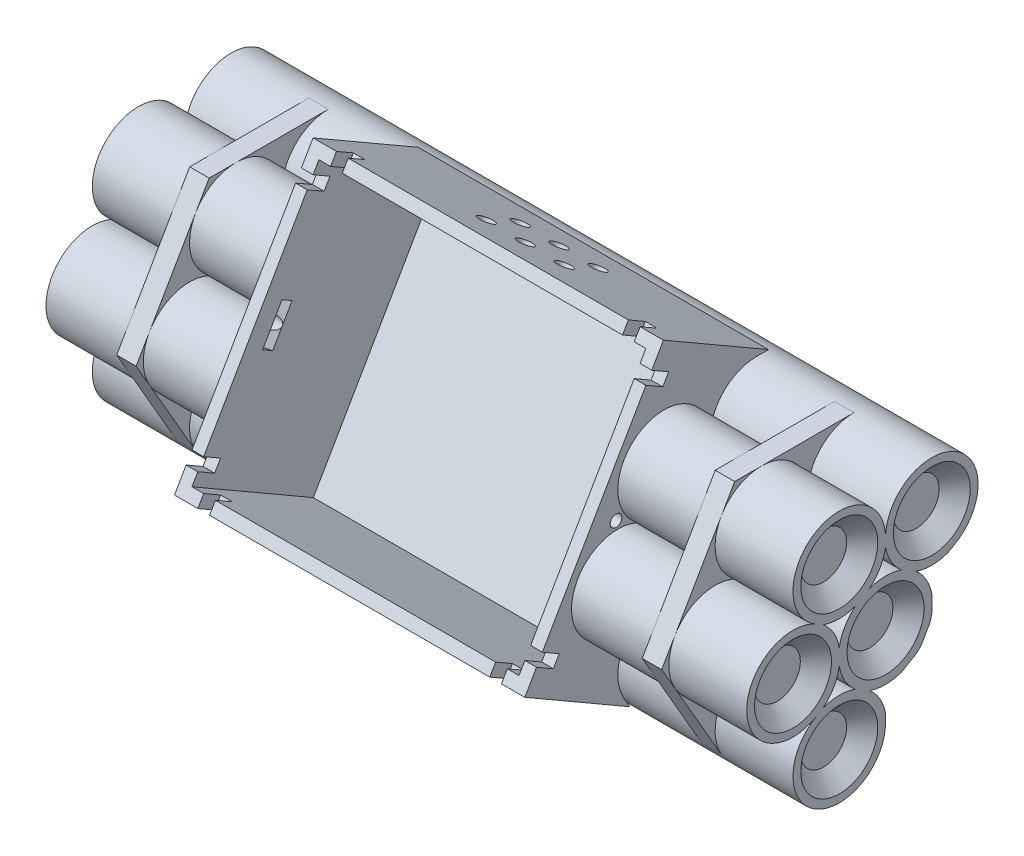
from build123d import *
from build123d.topology import SkipClean

# Parameters (mm, degrees)
BOSS_EXTRUDE1_DEPTH             = 5
BOSS_EXTRUDE7_DEPTH             = 20
BOSS_EXTRUDE7_DEPTH_BACK        = 160
LPATTERN1_COUNT                 = 2
LPATTERN1_PITCH                 = 135
CUT_EXTRUDE4_START              = -10
SKETCH7_R                       = 10
CUT_EXTRUDE4_DEPTH              = 160
CUT_EXTRUDE5_DEPTH              = 187.710839268
BOSS_EXTRUDE9_START             = -110
BOSS_EXTRUDE9_DEPTH             = 90
FILLET6_R                       = 1
SKETCH14_W                      = 84
SKETCH14_H                      = 65.2
CUT_EXTRUDE6_DEPTH              = 2
SKETCH15_W                      = 10.666666666
SKETCH15_H                      = 4
SKETCH15_W_2                    = 74
SKETCH15_H_2                    = 10
SKETCH15_W_3                    = 10.666666667
BOSS_EXTRUDE10_DEPTH            = 2
CUT_EXTRUDE8_DEPTH              = 177.671640726
CUT_EXTRUDE9_START              = -10
SKETCH21_R                      = 9.887023679
CUT_EXTRUDE9_DEPTH              = 4
BOSS_EXTRUDE11_START            = 160
SKETCH26_R                      = 10
BOSS_EXTRUDE11_DEPTH            = 160
CUT_EXTRUDE10_DEPTH             = 192.282170201
CUT_EXTRUDE10_DEPTH_BACK        = 192.282170201
CUT_EXTRUDE11_DEPTH             = 173.156523655
CUT_EXTRUDE11_DEPTH_BACK        = 173.156523655
CHAMFER1_SIZE                   = 4
CUT_EXTRUDE12_DEPTH             = 177.671640726
CUT_EXTRUDE12_DEPTH_BACK        = 177.671640726
CUT_EXTRUDE13_DEPTH             = 155.395170381
BOSS_EXTRUDE14_DEPTH            = 90
SKETCH33_W                      = 84
SKETCH33_H                      = 65.2
CUT_EXTRUDE14_DEPTH             = 36
BOSS_EXTRUDE15_DEPTH            = 3
BOSS_EXTRUDE16_DEPTH            = 3
BOSS_EXTRUDE17_START            = -5
BOSS_EXTRUDE17_DEPTH            = 5
BOSS_EXTRUDE18_DEPTH            = 5
BOSS_EXTRUDE19_START            = -28
BOSS_EXTRUDE19_DEPTH            = 28
BOSS_EXTRUDE20_DEPTH            = 28
CUT_EXTRUDE15_REACH             = 181.77
SKETCH47_R                      = 2
SKETCH48_W                      = 3
SKETCH48_H                      = 3
CUT_EXTRUDE16_DEPTH             = 5
CUT_EXTRUDE17_DEPTH             = 5
CUT_EXTRUDE17_DEPTH_BACK        = 5
CUT_EXTRUDE18_REACH             = 150.343
SKETCH52_R                      = 1.5
CUT_EXTRUDE18_DIRECTION_2_REACH = 150.343


# Read off the part's stored shape, not the designer's step: Boss-Extrude9
with BuildPart() as part:
    # Sketch3 → Boss-Extrude1 (new body)
    with BuildSketch(Plane(origin=(0, 0, 0), x_dir=(0, 0, -1), z_dir=(1, 0, 0))):
        Polygon((18.75, 32.475952642), (-18.75, 32.475952642), (-37.5, 0), (-18.75, -32.475952642), (18.75, -32.475952642), (37.5, 0), align=None)
    boss_extrude1 = extrude(amount=BOSS_EXTRUDE1_DEPTH)

    # Sketch4 → Boss-Extrude7 (add, two sides: drawn at the far end of the back side and taken through both)
    with BuildSketch(Plane(origin=(5, 0, 0), x_dir=(0, 0, -1), z_dir=(1, 0, 0)).offset(-BOSS_EXTRUDE7_DEPTH_BACK)):
        with BuildLine():
            ThreePointArc((0, 20.588928963), (-17.830535519, 30.883393444), (-17.830535519, 10.294464481))
            ThreePointArc((-17.830535519, 10.294464481), (-35.661071037, 0), (-17.830535519, -10.294464481))
            ThreePointArc((-17.830535519, -10.294464481), (-17.830535519, -30.883393444), (0, -20.588928963))
            ThreePointArc((0, -20.588928963), (17.830535519, -30.883393444), (17.830535519, -10.294464481))
            ThreePointArc((17.830535519, -10.294464481), (35.661071037, 0), (17.830535519, 10.294464481))
            ThreePointArc((17.830535519, 10.294464481), (17.830535519, 30.883393444), (0, 20.588928963))
        make_face()
    extrude(amount=BOSS_EXTRUDE7_DEPTH + BOSS_EXTRUDE7_DEPTH_BACK)

    # LPattern1: Boss-Extrude1 ×2
    with Locations(*[(-i * LPATTERN1_PITCH, 0, 0) for i in range(1, LPATTERN1_COUNT)]):
        add(boss_extrude1)

    # Sketch7 → Cut-Extrude4 (cut)
    with BuildSketch(Plane(origin=(25, 0, 0), x_dir=(0, 0, -1), z_dir=(1, 0, 0)).offset(CUT_EXTRUDE4_START)):
        with Locations((-11.887023679, 20.588928963)):
            Circle(SKETCH7_R)
        with Locations((11.887023679, 20.588928963)):
            Circle(SKETCH7_R)
        Circle(SKETCH7_R)
        with Locations((23.774047358, 0)):
            Circle(SKETCH7_R)
        with Locations((11.887023679, -20.588928963)):
            Circle(SKETCH7_R)
        with Locations((-11.887023679, -20.588928963)):
            Circle(SKETCH7_R)
        with Locations((-23.774047358, 0)):
            Circle(SKETCH7_R)
    extrude(amount=-CUT_EXTRUDE4_DEPTH, mode=Mode.SUBTRACT)

    # Sketch10 → Cut-Extrude5 (cut, through all)
    with BuildSketch(Plane(origin=(25, 0, 0), x_dir=(0, 0, -1), z_dir=(1, 0, 0))):
        with BuildLine():
            ThreePointArc((-15.978981211, 9.225469104), (-11.887023679, 8.511166901), (-7.795066147, 9.225469104))
            ThreePointArc((-7.795066147, 9.225469104), (-10.459648766, 6.038881031), (-11.887023679, 2.137990756))
            ThreePointArc((-11.887023679, 2.137990756), (-13.314398592, 6.038881031), (-15.978981211, 9.225469104))
        make_face()
        with BuildLine():
            ThreePointArc((0, 18.450938207), (1.427374913, 14.550047932), (4.091957532, 11.363459859))
            ThreePointArc((4.091957532, 11.363459859), (0, 12.077762062), (-4.091957532, 11.363459859))
            ThreePointArc((-4.091957532, 11.363459859), (-1.427374913, 14.550047932), (0, 18.450938207))
        make_face()
        with BuildLine():
            ThreePointArc((15.978981211, 9.225469104), (13.314398592, 6.038881031), (11.887023679, 2.137990756))
            ThreePointArc((11.887023679, 2.137990756), (10.459648766, 6.038881031), (7.795066147, 9.225469104))
            ThreePointArc((7.795066147, 9.225469104), (11.887023679, 8.511166901), (15.978981211, 9.225469104))
        make_face()
        with BuildLine():
            ThreePointArc((15.978981211, -9.225469104), (11.887023679, -8.511166901), (7.795066147, -9.225469104))
            ThreePointArc((7.795066147, -9.225469104), (10.459648766, -6.038881031), (11.887023679, -2.137990756))
            ThreePointArc((11.887023679, -2.137990756), (13.314398592, -6.038881031), (15.978981211, -9.225469104))
        make_face()
        with BuildLine():
            ThreePointArc((0, -18.450938207), (-1.427374913, -14.550047932), (-4.091957532, -11.363459859))
            ThreePointArc((-4.091957532, -11.363459859), (0, -12.077762062), (4.091957532, -11.363459859))
            ThreePointArc((4.091957532, -11.363459859), (1.427374913, -14.550047932), (0, -18.450938207))
        make_face()
        with BuildLine():
            ThreePointArc((-15.978981211, -9.225469104), (-13.314398592, -6.038881031), (-11.887023679, -2.137990756))
            ThreePointArc((-11.887023679, -2.137990756), (-10.459648766, -6.038881031), (-7.795066147, -9.225469104))
            ThreePointArc((-7.795066147, -9.225469104), (-11.887023679, -8.511166901), (-15.978981211, -9.225469104))
        make_face()
    extrude(amount=-CUT_EXTRUDE5_DEPTH, mode=Mode.SUBTRACT)

    # Boss-Extrude9 outline → Boss-Extrude9 (add)
    with BuildSketch(Plane.YZ.offset(BOSS_EXTRUDE9_START)):
        with BuildLine():
            Line((-9.592528054, 54.585254038), (-30.228803441, 18.842176589))
            ThreePointArc((-30.228803441, 18.842176589), (-19.986453709, 23.758769782), (-10.294464481, 17.830535519))
            ThreePointArc((-10.294464481, 17.830535519), (0, 35.661071037), (10.294464481, 17.830535519))
            ThreePointArc((10.294464481, 17.830535519), (30.883393444, 17.830535519), (20.588928963, 0))
            ThreePointArc((20.588928963, 0), (30.568925047, -5.429391752), (31.432205309, -16.75782341))
            Line((31.432205309, -16.75782341), (52.068480696, 18.985254038))
            Line((52.068480696, 18.985254038), (-9.592528054, 54.585254038))
        make_face()
    extrude(amount=BOSS_EXTRUDE9_DEPTH)

    # Fillet6
    fillet6_edges = [part.edges().sort_by_distance(p)[0] for p in [
        (-110, 21.237976321, 36.785254038),
        (-65, -9.592528054, 54.585254038),
        (-20, 21.237976321, 36.785254038),
        (-65, 52.068480696, 18.985254038),
    ]]
    fillet(fillet6_edges, radius=FILLET6_R)

    # Sketch14 → Cut-Extrude6 (cut)
    with BuildSketch(Plane(origin=(0, 21.237976321, 36.785254038), x_dir=(1, 0, 0), z_dir=(0, 0.49999999999999967, 0.8660254037844389))):
        with Locations((-65, 0)):
            Rectangle(SKETCH14_W, SKETCH14_H)
    extrude(amount=-CUT_EXTRUDE6_DEPTH, mode=Mode.SUBTRACT)

    # Sketch15 → Boss-Extrude10 (add)
    with BuildSketch(Plane(origin=(0, 20.237976321, 35.05320323), x_dir=(1, 0, 0), z_dir=(0, 0.4999999999999996, 0.8660254037844389))):
        with Locations((-84, 15.6)):
            Rectangle(SKETCH15_W, SKETCH15_H)
        with Locations((-65, 24.6)):
            Rectangle(SKETCH15_W_2, SKETCH15_H_2)
        with Locations((-96.666666666, 15.6)):
            Rectangle(SKETCH15_W_3, SKETCH15_H)
        with Locations((-71.333333334, 15.6)):
            Rectangle(SKETCH15_W_3, SKETCH15_H)
        with Locations((-58.666666667, 15.6)):
            Rectangle(SKETCH15_W_3, SKETCH15_H)
        with Locations((-46, 15.6)):
            Rectangle(SKETCH15_W, SKETCH15_H)
        with Locations((-33.333333334, 15.6)):
            Rectangle(SKETCH15_W_3, SKETCH15_H)
        with Locations((-84, 9.6)):
            Rectangle(SKETCH15_W, SKETCH15_H)
        with Locations((-71.333333334, 9.6)):
            Rectangle(SKETCH15_W_3, SKETCH15_H)
        with Locations((-58.666666667, 9.6)):
            Rectangle(SKETCH15_W_3, SKETCH15_H)
        with Locations((-46, 9.6)):
            Rectangle(SKETCH15_W, SKETCH15_H)
        with Locations((-33.333333334, 9.6)):
            Rectangle(SKETCH15_W_3, SKETCH15_H)
        with Locations((-84, 3.6)):
            Rectangle(SKETCH15_W, SKETCH15_H)
        with Locations((-71.333333334, 3.6)):
            Rectangle(SKETCH15_W_3, SKETCH15_H)
        with Locations((-58.666666667, 3.6)):
            Rectangle(SKETCH15_W_3, SKETCH15_H)
        with Locations((-46, 3.6)):
            Rectangle(SKETCH15_W, SKETCH15_H)
        with Locations((-33.333333334, 3.6)):
            Rectangle(SKETCH15_W_3, SKETCH15_H)
        with Locations((-96.666666666, 9.6)):
            Rectangle(SKETCH15_W_3, SKETCH15_H)
        with Locations((-96.666666666, 3.6)):
            Rectangle(SKETCH15_W_3, SKETCH15_H)
    extrude(amount=BOSS_EXTRUDE10_DEPTH)

    # loft from a face of the part (loft1)
    loft([part.faces().sort_by_distance((-38.666666667, 23.855667775, 34.119228634))[0], part.faces().sort_by_distance((-40.666666667, 23.855667775, 34.119228634))[0]])

    # loft from a face of the part (loft2)
    loft([part.faces().sort_by_distance((-38.666666667, 29.051820197, 31.119228634))[0], part.faces().sort_by_distance((-40.666666667, 29.051820197, 31.119228634))[0]])

    # loft from a face of the part (loft3)
    loft([part.faces().sort_by_distance((-40.666666667, 34.24797262, 28.119228634))[0], part.faces().sort_by_distance((-38.666666667, 34.24797262, 28.119228634))[0]])

    # Sketch17 → Cut-Extrude8 (cut, through all)
    with BuildSketch(Plane(origin=(5, 0, 0), x_dir=(0, 0, -1), z_dir=(1, 0, 0))):
        with BuildLine():
            Line((3.441779924, 30.975952642), (-3.441779924, 30.975952642))
            ThreePointArc((-3.441779924, 30.975952642), (-1.503231797, 29.038146035), (0, 26.746125649))
            ThreePointArc((0, 26.746125649), (1.503231797, 29.038146035), (3.441779924, 30.975952642))
        make_face()
        with BuildLine():
            Line((-25.105071932, 18.46864517), (-28.546851857, 12.507307472))
            ThreePointArc((-28.546851857, 12.507307472), (-25.899388044, 13.217236094), (-23.162824265, 13.373062825))
            ThreePointArc((-23.162824265, 13.373062825), (-24.396156247, 15.820909942), (-25.105071932, 18.46864517))
        make_face()
        with BuildLine():
            Line((28.546851857, 12.507307472), (25.105071932, 18.46864517))
            ThreePointArc((25.105071932, 18.46864517), (24.396156247, 15.820909942), (23.162824265, 13.373062825))
            ThreePointArc((23.162824265, 13.373062825), (25.899388044, 13.217236094), (28.546851857, 12.507307472))
        make_face()
        with BuildLine():
            Line((25.105071932, -18.46864517), (28.546851857, -12.507307472))
            ThreePointArc((28.546851857, -12.507307472), (25.899388044, -13.217236094), (23.162824265, -13.373062825))
            ThreePointArc((23.162824265, -13.373062825), (24.396156247, -15.820909942), (25.105071932, -18.46864517))
        make_face()
        with BuildLine():
            Line((-3.441779924, -30.975952642), (3.441779924, -30.975952642))
            ThreePointArc((3.441779924, -30.975952642), (1.503231797, -29.038146035), (0, -26.746125649))
            ThreePointArc((0, -26.746125649), (-1.503231797, -29.038146035), (-3.441779924, -30.975952642))
        make_face()
        with BuildLine():
            Line((-28.546851857, -12.507307472), (-25.105071932, -18.46864517))
            ThreePointArc((-25.105071932, -18.46864517), (-24.396156247, -15.820909942), (-23.162824265, -13.373062825))
            ThreePointArc((-23.162824265, -13.373062825), (-25.899388044, -13.217236094), (-28.546851857, -12.507307472))
        make_face()
    extrude(amount=-CUT_EXTRUDE8_DEPTH, mode=Mode.SUBTRACT)

    # Sketch21 → Cut-Extrude9 (cut)
    with BuildSketch(Plane(origin=(-145, 0, 0), x_dir=(0, 0, -1), z_dir=(1, 0, 0)).offset(CUT_EXTRUDE9_START)):
        with Locations((11.887023679, 20.588928963)):
            Circle(SKETCH21_R)
        with Locations((-11.887023679, 20.588928963)):
            Circle(SKETCH21_R)
        with Locations((23.774047358, 0)):
            Circle(SKETCH21_R)
        with Locations((11.887023679, -20.588928963)):
            Circle(SKETCH21_R)
        with Locations((-11.887023679, -20.588928963)):
            Circle(SKETCH21_R)
        with Locations((-23.774047358, 0)):
            Circle(SKETCH21_R)
        Circle(SKETCH21_R)
    cut_extrude9 = extrude(amount=CUT_EXTRUDE9_DEPTH, mode=Mode.SUBTRACT)

    # Mirror1: Cut-Extrude9 across plane
    add(cut_extrude9.mirror(Plane(origin=(-65, 0, 0), x_dir=(0, 0, 1), z_dir=(1, 0, 0))), mode=Mode.SUBTRACT)

    # Sketch26 → Boss-Extrude11 (add)
    with BuildSketch(Plane(origin=(-145, 0, 0), x_dir=(0, 0, -1), z_dir=(1, 0, 0)).offset(BOSS_EXTRUDE11_START)):
        with Locations((11.887023679, -20.588928963)):
            Circle(SKETCH26_R)
        with Locations((-11.887023679, -20.588928963)):
            Circle(SKETCH26_R)
        with Locations((-23.774047358, 0)):
            Circle(SKETCH26_R)
        with Locations((-11.887023679, 20.588928963)):
            Circle(SKETCH26_R)
        with Locations((11.887023679, 20.588928963)):
            Circle(SKETCH26_R)
        Circle(SKETCH26_R)
        with Locations((23.774047358, 0)):
            Circle(SKETCH26_R)
    extrude(amount=-BOSS_EXTRUDE11_DEPTH)

    # Sketch27 → Cut-Extrude10 (cut, two sides: drawn at the far end of the back side and taken through both)
    with SkipClean():  # the faces are left unmerged after this step: merging them gives an invalid solid
        with BuildSketch(Plane(origin=(21, 0, 0), x_dir=(0, 0, -1), z_dir=(1, 0, 0)).offset(-CUT_EXTRUDE10_DEPTH_BACK)):
            with BuildLine():
                Line((17.830535519, 10.294464481), (15.978981211, 9.225469104))
                ThreePointArc((15.978981211, 9.225469104), (13.314398592, 6.038881031), (11.887023679, 2.137990756))
                Line((11.887023679, 2.137990756), (11.887023679, -2.137990756))
                ThreePointArc((11.887023679, -2.137990756), (10.459648766, -6.038881031), (7.795066147, -9.225469104))
                Line((7.795066147, -9.225469104), (4.091957532, -11.363459859))
                ThreePointArc((4.091957532, -11.363459859), (1.427374913, -14.550047932), (0, -18.450938207))
                Line((0, -18.450938207), (0, -20.588928963))
                ThreePointArc((0, -20.588928963), (-3.481628627, -28.994324014), (-11.887023679, -32.475952642))
                Line((-11.887023679, -32.475952642), (11.887023679, -32.475952642))
                Line((11.887023679, -32.475952642), (18.75, -32.475952642))
                Line((18.75, -32.475952642), (22.18148816, -26.532440802))
                Line((22.18148816, -26.532440802), (34.06851184, -5.94351184))
                Line((34.06851184, -5.94351184), (37.5, 0))
                Line((37.5, 0), (34.06851184, 5.94351184))
                Line((34.06851184, 5.94351184), (22.18148816, 26.532440802))
                ThreePointArc((22.18148816, 26.532440802), (23.369006848, 17.512340845), (17.830535519, 10.294464481))
            make_face()
        extrude(amount=CUT_EXTRUDE10_DEPTH + CUT_EXTRUDE10_DEPTH_BACK, mode=Mode.SUBTRACT)
    add(part.part.scale(1), mode=Mode.REPLACE)  # the faces are merged on a copy

    # Sketch28 → Cut-Extrude11 (cut, two sides: drawn at the far end of the back side and taken through both)
    with BuildSketch(Plane(origin=(0, 0, 0), x_dir=(0, 0, -1), z_dir=(1, 0, 0)).offset(-CUT_EXTRUDE11_DEPTH_BACK)):
        Polygon((22.18148816, 14.645417123), (-1.592559198, -26.532440802), (30.883393444, -17.830535519), align=None)
    extrude(amount=CUT_EXTRUDE11_DEPTH + CUT_EXTRUDE11_DEPTH_BACK, mode=Mode.SUBTRACT)

    # Chamfer1
    chamfer1_edges = [part.edges().sort_by_distance(p)[0] for p in [
        (-151, 20.588928963, 21.774047358),
        (-151, 20.588928963, -2),
        (-151, 0, 9.887023679),
        (-151, -20.588928963, 21.774047358),
        (-151, 0, 33.661071037),
        (21, 20.588928963, 21.774047358),
        (21, 20.588928963, -2),
        (21, 0, 9.887023679),
        (21, -20.588928963, 21.774047358),
        (21, 0, 33.661071037),
    ]]
    chamfer(chamfer1_edges, length=CHAMFER1_SIZE - 0.0001)  # a hair under: the kernel refuses the full size

    # Sketch29 → Cut-Extrude12 (cut, two sides: drawn at the far end of the back side and taken through both)
    with BuildSketch(Plane(origin=(5, 0, 0), x_dir=(0, 0, -1), z_dir=(1, 0, 0)).offset(-CUT_EXTRUDE12_DEPTH_BACK)):
        with BuildLine():
            Line((-22.18148816, -26.532440802), (-18.75, -32.475952642))
            Line((-18.75, -32.475952642), (-11.887023679, -32.475952642))
            ThreePointArc((-11.887023679, -32.475952642), (-17.830535519, -30.883393444), (-22.18148816, -26.532440802))
        make_face()
        with BuildLine():
            Line((22.18148816, 26.532440802), (18.75, 32.475952642))
            Line((18.75, 32.475952642), (11.887023679, 32.475952642))
            ThreePointArc((11.887023679, 32.475952642), (17.830535519, 30.883393444), (22.18148816, 26.532440802))
        make_face()
    extrude(amount=CUT_EXTRUDE12_DEPTH + CUT_EXTRUDE12_DEPTH_BACK, mode=Mode.SUBTRACT)

    # Sketch31 → Cut-Extrude13 (cut, through all)
    with BuildSketch(Plane.ZY.offset(110)):
        Polygon((47.657050808, -13.592528054), (12.057050808, 48.068480696), (18.985254038, 52.068480696), (54.585254038, -9.592528054), align=None)
    extrude(amount=-CUT_EXTRUDE13_DEPTH, mode=Mode.SUBTRACT)

    # Sketch32 → Boss-Extrude14 (add)
    with BuildSketch(Plane(origin=(-20, 0, 0), x_dir=(0, 0, -1), z_dir=(1, 0, 0))):
        with BuildLine():
            Line((-28.546851857, 12.507307472), (-25.105071932, 18.46864517))
            ThreePointArc((-25.105071932, 18.46864517), (-24.396156247, 15.820909942), (-23.162824265, 13.373062825))
            ThreePointArc((-23.162824265, 13.373062825), (-25.899388044, 13.217236094), (-28.546851857, 12.507307472))
        make_face()
    extrude(amount=-BOSS_EXTRUDE14_DEPTH)

    # Sketch33 → Cut-Extrude14 (cut)
    with BuildSketch(Plane(origin=(0, 17.237976321, 29.857050808), x_dir=(1, 0, 0), z_dir=(0, 0.5000000000000004, 0.8660254037844385))):
        with Locations((-65, 0)):
            Rectangle(SKETCH33_W, SKETCH33_H)
    extrude(amount=-CUT_EXTRUDE14_DEPTH, mode=Mode.SUBTRACT)

    # Sketch39 → Boss-Extrude15 (add)
    with BuildSketch(Plane.ZY.offset(23)):
        Polygon((46.157050808, -10.994451842), (13.557050808, 45.470404484), (-17.619863729, 27.470404484), (14.980136271, -28.994451842), align=None)
    extrude(amount=-BOSS_EXTRUDE15_DEPTH)

    # Sketch40 → Boss-Extrude16 (add)
    with BuildSketch(Plane(origin=(-107, 0, 0), x_dir=(0, 0, -1), z_dir=(1, 0, 0))):
        Polygon((-13.557050808, 45.470404484), (-46.157050808, -10.994451842), (-14.980136271, -28.994451842), (17.619863729, 27.470404484), align=None)
    extrude(amount=-BOSS_EXTRUDE16_DEPTH)

    # Sketch41 → Boss-Extrude17 (add)
    with BuildSketch(Plane.ZY.offset(135).offset(BOSS_EXTRUDE17_START)):
        with BuildLine():
            Line((-3.441779924, 30.975952642), (3.441779924, 30.975952642))
            ThreePointArc((3.441779924, 30.975952642), (1.503231797, 29.038146035), (0, 26.746125649))
            ThreePointArc((0, 26.746125649), (-1.503231797, 29.038146035), (-3.441779924, 30.975952642))
        make_face()
        with BuildLine():
            Line((25.105071932, 18.46864517), (28.546851857, 12.507307472))
            ThreePointArc((28.546851857, 12.507307472), (25.899388044, 13.217236094), (23.162824265, 13.373062825))
            ThreePointArc((23.162824265, 13.373062825), (24.396156247, 15.820909942), (25.105071932, 18.46864517))
        make_face()
        with BuildLine():
            Line((28.546851857, -12.507307472), (25.105071932, -18.46864517))
            ThreePointArc((25.105071932, -18.46864517), (24.396156247, -15.820909942), (23.162824265, -13.373062825))
            ThreePointArc((23.162824265, -13.373062825), (25.899388044, -13.217236094), (28.546851857, -12.507307472))
        make_face()
    extrude(amount=BOSS_EXTRUDE17_DEPTH)

    # Sketch42 → Boss-Extrude18 (add)
    with BuildSketch(Plane(origin=(5, 0, 0), x_dir=(0, 0, -1), z_dir=(1, 0, 0))):
        with BuildLine():
            Line((-28.546851857, -12.507307472), (-25.105071932, -18.46864517))
            ThreePointArc((-25.105071932, -18.46864517), (-24.396156247, -15.820909942), (-23.162824265, -13.373062825))
            ThreePointArc((-23.162824265, -13.373062825), (-25.899388044, -13.217236094), (-28.546851857, -12.507307472))
        make_face()
        with BuildLine():
            Line((3.441779924, 30.975952642), (-3.441779924, 30.975952642))
            ThreePointArc((-3.441779924, 30.975952642), (-1.503231797, 29.038146035), (0, 26.746125649))
            ThreePointArc((0, 26.746125649), (1.503231797, 29.038146035), (3.441779924, 30.975952642))
        make_face()
        with BuildLine():
            Line((-25.105071932, 18.46864517), (-28.546851857, 12.507307472))
            ThreePointArc((-28.546851857, 12.507307472), (-25.899388044, 13.217236094), (-23.162824265, 13.373062825))
            ThreePointArc((-23.162824265, 13.373062825), (-24.396156247, 15.820909942), (-25.105071932, 18.46864517))
        make_face()
    extrude(amount=-BOSS_EXTRUDE18_DEPTH)

    # Sketch45 → Boss-Extrude19 (add)
    with BuildSketch(Plane.ZY.offset(135).offset(BOSS_EXTRUDE19_START)):
        with BuildLine():
            ThreePointArc((4.091957532, 11.363459859), (0, 12.077762062), (-4.091957532, 11.363459859))
            ThreePointArc((-4.091957532, 11.363459859), (-1.427374913, 14.550047932), (0, 18.450938207))
            ThreePointArc((0, 18.450938207), (1.427374913, 14.550047932), (4.091957532, 11.363459859))
        make_face()
        with BuildLine():
            ThreePointArc((11.887023679, 2.137990756), (10.459648766, 6.038881031), (7.795066147, 9.225469104))
            ThreePointArc((7.795066147, 9.225469104), (11.887023679, 8.511166901), (15.978981211, 9.225469104))
            ThreePointArc((15.978981211, 9.225469104), (13.314398592, 6.038881031), (11.887023679, 2.137990756))
        make_face()
        with BuildLine():
            ThreePointArc((7.795066147, -9.225469104), (10.459648766, -6.038881031), (11.887023679, -2.137990756))
            ThreePointArc((11.887023679, -2.137990756), (13.314398592, -6.038881031), (15.978981211, -9.225469104))
            ThreePointArc((15.978981211, -9.225469104), (11.887023679, -8.511166901), (7.795066147, -9.225469104))
        make_face()
    extrude(amount=BOSS_EXTRUDE19_DEPTH)

    # Sketch46 → Boss-Extrude20 (add)
    with BuildSketch(Plane(origin=(5, 0, 0), x_dir=(0, 0, -1), z_dir=(1, 0, 0))):
        with BuildLine():
            ThreePointArc((0, 18.450938207), (1.427374913, 14.550047932), (4.091957532, 11.363459859))
            ThreePointArc((4.091957532, 11.363459859), (0, 12.077762062), (-4.091957532, 11.363459859))
            ThreePointArc((-4.091957532, 11.363459859), (-1.427374913, 14.550047932), (0, 18.450938207))
        make_face()
        with BuildLine():
            ThreePointArc((-15.978981211, 9.225469104), (-11.887023679, 8.511166901), (-7.795066147, 9.225469104))
            ThreePointArc((-7.795066147, 9.225469104), (-10.459648766, 6.038881031), (-11.887023679, 2.137990756))
            ThreePointArc((-11.887023679, 2.137990756), (-13.314398592, 6.038881031), (-15.978981211, 9.225469104))
        make_face()
        with BuildLine():
            ThreePointArc((-15.978981211, -9.225469104), (-13.314398592, -6.038881031), (-11.887023679, -2.137990756))
            ThreePointArc((-11.887023679, -2.137990756), (-10.459648766, -6.038881031), (-7.795066147, -9.225469104))
            ThreePointArc((-7.795066147, -9.225469104), (-11.887023679, -8.511166901), (-15.978981211, -9.225469104))
        make_face()
    extrude(amount=-BOSS_EXTRUDE20_DEPTH)

    # Sketch47 → Cut-Extrude15 (cut, up to next)
    with BuildSketch(Plane(origin=(0, 30.830504375, -17.8), x_dir=(1, 0, 0), z_dir=(0, 0.8660254037844389, -0.4999999999999995)), mode=Mode.PRIVATE) as cut_extrude15_sk1:
        with Locations(Location((-75, -23.475952642, 0), (0, 0, 270))):
            Circle(SKETCH47_R)
    cut_extrude15_tool1 = extrude(cut_extrude15_sk1.sketch, amount=-CUT_EXTRUDE15_REACH, mode=Mode.PRIVATE) & part.part
    # Sketch47 → Cut-Extrude15 (cut, up to next)
    with BuildSketch(Plane(origin=(0, 30.830504375, -17.8), x_dir=(1, 0, 0), z_dir=(0, 0.8660254037844389, -0.4999999999999995)), mode=Mode.PRIVATE) as cut_extrude15_sk2:
        with Locations(Location((-65, -23.475952642, 0), (0, 0, 270))):
            Circle(SKETCH47_R)
    cut_extrude15_tool2 = extrude(cut_extrude15_sk2.sketch, amount=-CUT_EXTRUDE15_REACH, mode=Mode.PRIVATE) & part.part
    # Sketch47 → Cut-Extrude15 (cut, up to next)
    with BuildSketch(Plane(origin=(0, 30.830504375, -17.8), x_dir=(1, 0, 0), z_dir=(0, 0.8660254037844389, -0.4999999999999995)), mode=Mode.PRIVATE) as cut_extrude15_sk3:
        with Locations(Location((-55, -23.475952642, 0), (0, 0, 270))):
            Circle(SKETCH47_R)
    cut_extrude15_tool3 = extrude(cut_extrude15_sk3.sketch, amount=-CUT_EXTRUDE15_REACH, mode=Mode.PRIVATE) & part.part
    # Sketch47 → Cut-Extrude15 (cut, up to next)
    with BuildSketch(Plane(origin=(0, 30.830504375, -17.8), x_dir=(1, 0, 0), z_dir=(0, 0.8660254037844389, -0.4999999999999995)), mode=Mode.PRIVATE) as cut_extrude15_sk4:
        with Locations(Location((-65, -13.475952642, 0), (0, 0, 270))):
            Circle(SKETCH47_R)
    cut_extrude15_tool4 = extrude(cut_extrude15_sk4.sketch, amount=-CUT_EXTRUDE15_REACH, mode=Mode.PRIVATE) & part.part
    # Sketch47 → Cut-Extrude15 (cut, up to next)
    with BuildSketch(Plane(origin=(0, 30.830504375, -17.8), x_dir=(1, 0, 0), z_dir=(0, 0.8660254037844389, -0.4999999999999995)), mode=Mode.PRIVATE) as cut_extrude15_sk5:
        with Locations(Location((-55, -13.475952642, 0), (0, 0, 270))):
            Circle(SKETCH47_R)
    cut_extrude15_tool5 = extrude(cut_extrude15_sk5.sketch, amount=-CUT_EXTRUDE15_REACH, mode=Mode.PRIVATE) & part.part
    # Sketch47 → Cut-Extrude15 (cut, up to next)
    with BuildSketch(Plane(origin=(0, 30.830504375, -17.8), x_dir=(1, 0, 0), z_dir=(0, 0.8660254037844389, -0.4999999999999995)), mode=Mode.PRIVATE) as cut_extrude15_sk6:
        with Locations(Location((-75, -13.475952642, 0), (0, 0, 270))):
            Circle(SKETCH47_R)
    cut_extrude15_tool6 = extrude(cut_extrude15_sk6.sketch, amount=-CUT_EXTRUDE15_REACH, mode=Mode.PRIVATE) & part.part
    add(cut_extrude15_tool1.solids().sort_by_distance((-75, 42.568481, 2.530771))[0], mode=Mode.SUBTRACT)
    add(cut_extrude15_tool2.solids().sort_by_distance((-65, 42.568481, 2.530771))[0], mode=Mode.SUBTRACT)
    add(cut_extrude15_tool3.solids().sort_by_distance((-55, 42.568481, 2.530771))[0], mode=Mode.SUBTRACT)
    add(cut_extrude15_tool4.solids().sort_by_distance((-65, 37.568481, -6.129483))[0], mode=Mode.SUBTRACT)
    add(cut_extrude15_tool5.solids().sort_by_distance((-55, 37.568481, -6.129483))[0], mode=Mode.SUBTRACT)
    add(cut_extrude15_tool6.solids().sort_by_distance((-75, 37.568481, -6.129483))[0], mode=Mode.SUBTRACT)

    # Sketch48 → Cut-Extrude16 (cut)
    with BuildSketch(Plane(origin=(0, 17.237976321, 29.857050808), x_dir=(1, 0, 0), z_dir=(0, 0.5000000000000002, 0.8660254037844385))):
        with Locations((-102.5, 34.1)):
            Rectangle(SKETCH48_W, SKETCH48_H)
        with Locations((-102.5, -34.1)):
            Rectangle(SKETCH48_W, SKETCH48_H)
        with Locations((-21.5, -28.1)):
            Rectangle(SKETCH48_W, SKETCH48_H)
        with Locations((-21.5, 28.1)):
            Rectangle(SKETCH48_W, SKETCH48_H)
        with Locations((-108.5, 28.1)):
            Rectangle(SKETCH48_W, SKETCH48_H)
        with Locations((-108.5, -28.1)):
            Rectangle(SKETCH48_W, SKETCH48_H)
        with Locations((-27.5, 34.1)):
            Rectangle(SKETCH48_W, SKETCH48_H)
        with Locations((-27.5, -34.1)):
            Rectangle(SKETCH48_W, SKETCH48_H)
    extrude(amount=-CUT_EXTRUDE16_DEPTH, mode=Mode.SUBTRACT)

    # Sketch50 → Cut-Extrude17 (cut, two sides: drawn at the far end of the back side and taken through both)
    with BuildSketch(Plane(origin=(0, 0, 0), x_dir=(-1, 0, 0), z_dir=(0, -0.8660254037844384, 0.5000000000000006)).offset(-CUT_EXTRUDE17_DEPTH_BACK)):
        Polygon((23, -26.475952642), (21.5, -27.975952642), (23, -29.475952642), align=None)
        Polygon((107, -26.475952642), (108.5, -27.975952642), (107, -29.475952642), align=None)
    extrude(amount=CUT_EXTRUDE17_DEPTH + CUT_EXTRUDE17_DEPTH_BACK, mode=Mode.SUBTRACT)

    # Sketch52 → Cut-Extrude18 (cut, up to next)
    with BuildSketch(Plane(origin=(-107, 0, 0), x_dir=(0, 0, -1), z_dir=(1, 0, 0)), mode=Mode.PRIVATE) as cut_extrude18_sk1:
        with Locations(Location((-24.227885683, 13.987976321, 0), (0, 0, 150))):
            Circle(SKETCH52_R)
    cut_extrude18_tool1 = extrude(cut_extrude18_sk1.sketch, amount=-CUT_EXTRUDE18_REACH, mode=Mode.PRIVATE) & part.part
    add(cut_extrude18_tool1.solids().sort_by_distance((-107, 13.987976, 24.227886))[0], mode=Mode.SUBTRACT)

    # Cut-Extrude18 direction 2: up to this face of the body (flat: up to its plane)
    cut_extrude18_direction_2_end = Plane(part.part.faces().sort_by_distance((-20, 12.577577815, 21.785003811))[0])
    # Sketch52 → Cut-Extrude18 direction 2 (cut, up to the picked face)
    with BuildSketch(Plane(origin=(-107, 0, 0), x_dir=(0, 0, -1), z_dir=(1, 0, 0)), mode=Mode.PRIVATE) as cut_extrude18_direction_2_sk1:
        with Locations(Location((-24.227885683, 13.987976321, 0), (0, 0, 150))):
            Circle(SKETCH52_R)
    cut_extrude18_direction_2_tool1 = split(extrude(cut_extrude18_direction_2_sk1.sketch, amount=CUT_EXTRUDE18_DIRECTION_2_REACH, mode=Mode.PRIVATE), bisect_by=cut_extrude18_direction_2_end, keep=Keep.BOTH, mode=Mode.PRIVATE)
    add(cut_extrude18_direction_2_tool1.solids().sort_by(Axis((-107, 13.987976, 24.227886), (1, 0, 0)))[0], mode=Mode.SUBTRACT)


solid = part.part
